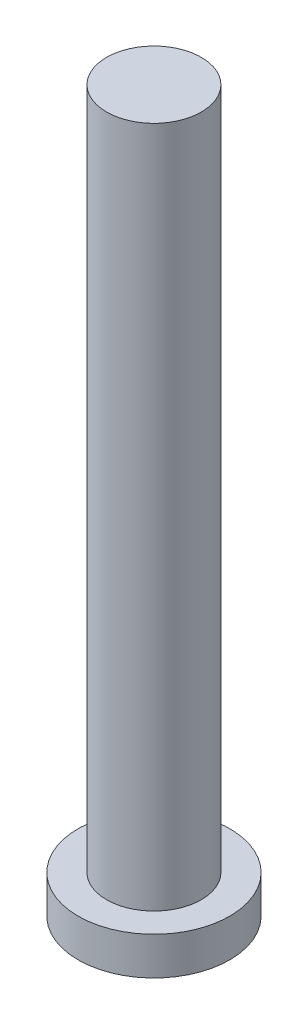
from build123d import *

# Parameters (mm, degrees)
SKETCH1_R           = 2.54
BOSS_EXTRUDE1_DEPTH = 1.27
SKETCH2_R           = 1.5875
BOSS_EXTRUDE2_DEPTH = 22.86


with BuildPart() as part:
    # Sketch1 → Boss-Extrude1 (new body)
    with BuildSketch(Plane(origin=(0, 0, 0), x_dir=(1, 0, 0), z_dir=(0, 1, 0))):
        Circle(SKETCH1_R)
    extrude(amount=BOSS_EXTRUDE1_DEPTH)

    # Sketch2 → Boss-Extrude2 (add)
    with BuildSketch(Plane(origin=(0, 1.27, 0), x_dir=(1, 0, 0), z_dir=(0, 1, 0))):
        Circle(SKETCH2_R)
    extrude(amount=BOSS_EXTRUDE2_DEPTH)


solid = part.part
